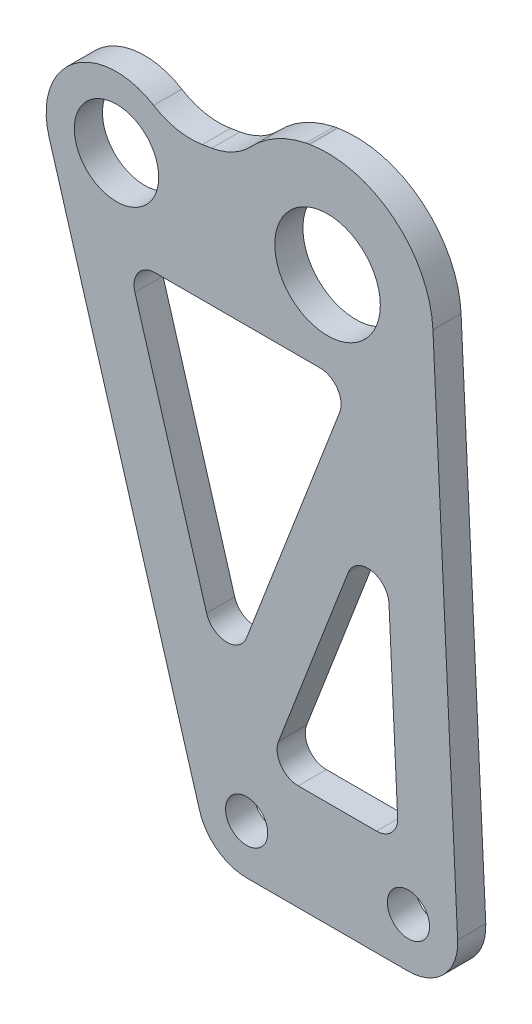
from build123d import *

# Parameters (mm, degrees)
SKETCH_1_R          = 3
SKETCH_1_R_2        = 7.5
SKETCH_1_R_3        = 6
EXTRUDE_1_DEPTH     = 4
CUT_EXTRUDE_START   = -10
CUT_EXTRUDE_2_DEPTH = 10
CUT_EXTRUDE_6_DEPTH = 10
FILLET_8_R          = 3
FILLET_9_R          = 10


with BuildPart() as part:
    # 草图1 → 凸台-拉伸1 (new body)
    with BuildSketch(Plane.XY):
        with BuildLine():
            Line((-39.588006912, 70.159203728), (-18.211604838, -1.988557391))
            ThreePointArc((-18.211604838, -1.988557391), (-15.688084184, -5.608917085), (-11.5, -7))
            Line((-11.5, -7), (11.5, -7))
            ThreePointArc((11.5, -7), (16.566581898, -4.83008777), (18.492010075, 0.334357752))
            Line((18.492010075, 0.334357752), (14.982878733, 73.716480896))
            ThreePointArc((14.982878733, 73.716480896), (9.406006267, 84.684478854), (-2.5, 87.790199458))
            Line((-2.5, 87.790199458), (-31.666666667, 82.860132972))
            ThreePointArc((-31.666666667, 82.860132972), (-38.485005613, 78.291944798), (-39.588006912, 70.159203728))
        make_face()
        with Locations((11.5, 0)):
            Circle(SKETCH_1_R, mode=Mode.SUBTRACT)
        with Locations((-11.5, 0)):
            Circle(SKETCH_1_R, mode=Mode.SUBTRACT)
        with Locations((0, 73)):
            Circle(SKETCH_1_R_2, mode=Mode.SUBTRACT)
        with Locations((-30, 73)):
            Circle(SKETCH_1_R_3, mode=Mode.SUBTRACT)
    extrude(amount=EXTRUDE_1_DEPTH)

    # 草图3 → 切除-拉伸2 (cut)
    with BuildSketch(Plane.XY.offset(4).offset(CUT_EXTRUDE_START)):
        with BuildLine():
            Line((-22.294207695, 79.373442159), (-12.695653982, 80.995893861))
            ThreePointArc((-12.695653982, 80.995893861), (-8.463678603, 85.388708293), (-2.832841434, 87.733938987))
            Line((-2.832841434, 87.733938987), (-31.666666667, 82.860132972))
            ThreePointArc((-31.666666667, 82.860132972), (-26.513309187, 82.372458972), (-22.294207695, 79.373442159))
        make_face()
    extrude(amount=CUT_EXTRUDE_2_DEPTH, mode=Mode.SUBTRACT)

    # 草图7 → 切除-拉伸6 (cut)
    with BuildSketch(Plane.XY.offset(4)):
        Polygon((3.295515487, 61), (-28.530502179, 61), (-14.691197263, 14.290789455), align=None)
        Polygon((10.116297473, 8), (8.055325934, 51.098548475), (-8.540998481, 8), align=None)
    extrude(amount=-CUT_EXTRUDE_6_DEPTH, mode=Mode.SUBTRACT)

    # 圆角8
    fillet_8_edges = [part.edges().sort_by_distance(p)[0] for p in [
        (8.055325934, 51.098548475, 2),
        (10.116297473, 8, 2),
        (-8.540998481, 8, 2),
        (3.295515487, 61, 2),
        (-14.691197263, 14.290789455, 2),
        (-28.530502179, 61, 2),
    ]]
    fillet(fillet_8_edges, radius=FILLET_8_R)

    # 圆角9
    # the kernel refuses this fillet: 10 mm, written as the material it adds along each edge
    with BuildSketch(Plane(origin=(-12.695653982, 80.995893861, 0), x_dir=(0.613787273879612, 0.789471457636965, 0), z_dir=(0, 0, 1))) as fillet_9_piece_1:
        with BuildLine():
            CenterArc((3.946152578, 9.951236707), FILLET_9_R, 227.457922435, 36.881499563)
            Line((-2.815162182, 2.583426808), (0, 0))
            ThreePointArc((0, 0), (1.479900866, 0.073163458), (2.959801732, 0))
        make_face()
    extrude(amount=4)
    with BuildSketch(Plane(origin=(-22.294207695, 79.373442159, 0), x_dir=(0.9860132971832692, 0.16666666666666718, 0), z_dir=(0, 0, 1))) as fillet_9_piece_2:
        with BuildLine():
            CenterArc((4.568502517, 10), FILLET_9_R, 228.590377891, 41.409622109)
            ThreePointArc((-2.04587576, 2.5), (-0.921320126, 1.33315892), (0, 0))
            Line((0, 0), (4.568502517, 0))
        make_face()
    extrude(amount=4)
    # the kernel refuses this fillet: 10 mm, written as the material it takes off along each edge
    with BuildSketch(Plane(origin=(-2.832841434, 87.733938987, -0.617519745), x_dir=(0.9860132971832704, 0.16666666666666025, 0), z_dir=(0, 0, 1))) as fillet_9_2_piece_1:
        with BuildLine():
            CenterArc((0.14264617, -10), FILLET_9_R, 90, 2.232449915)
            ThreePointArc((-0.246891263, -0.007589851), (-0.123461251, -0.003286845), (0, 0))
            Line((0, 0), (0.14264617, 0))
        make_face()
    extrude(amount=5.23503949, mode=Mode.SUBTRACT)


solid = part.part
